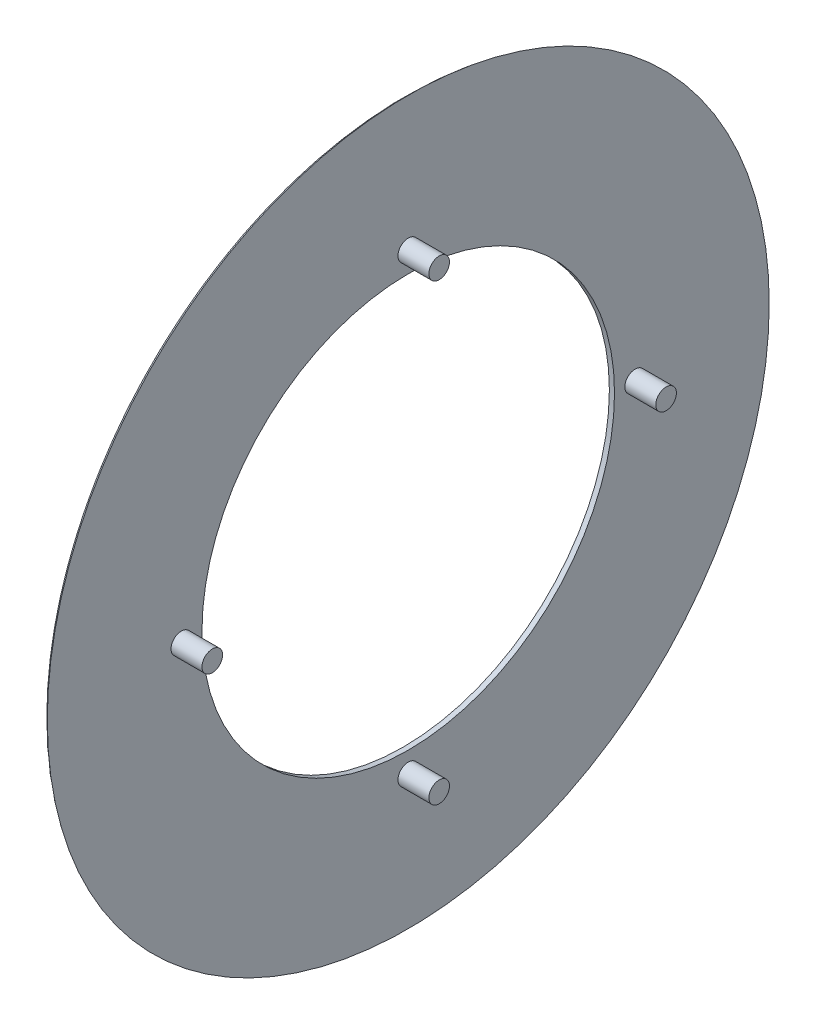
from build123d import *

# Parameters (mm, degrees)
SKETCH1_R           = 44.45
BOSS_EXTRUDE1_DEPTH = 0.635
SKETCH2_R           = 1.27
BOSS_EXTRUDE2_DEPTH = 3.81
CUT_EXTRUDE1_REACH  = 64.977
SKETCH3_R           = 25.4
FILLET1_R           = 1.27


with BuildPart() as part:
    # Sketch1 → Boss-Extrude1 (new body)
    with BuildSketch(Plane(origin=(0, 0, 0), x_dir=(0, 0, -1), z_dir=(1, 0, 0))):
        Circle(SKETCH1_R)
    extrude(amount=BOSS_EXTRUDE1_DEPTH)

    # Sketch2 → Boss-Extrude2 (add)
    with BuildSketch(Plane(origin=(0.635, 0, 0), x_dir=(0, 0, -1), z_dir=(1, 0, 0))):
        with Locations(Location((0, 27.94, 0), (0, 0, 180))):
            Circle(SKETCH2_R)
        with Locations(Location((27.94, 0, 0), (0, 0, 180))):
            Circle(SKETCH2_R)
        with Locations(Location((0, -27.94, 0), (0, 0, 180))):
            Circle(SKETCH2_R)
        with Locations(Location((-27.94, 0, 0), (0, 0, 180))):
            Circle(SKETCH2_R)
    extrude(amount=BOSS_EXTRUDE2_DEPTH)

    # Sketch3 → Cut-Extrude1 (cut, up to next)
    with BuildSketch(Plane(origin=(0.635, 0, 0), x_dir=(0, 0, -1), z_dir=(1, 0, 0)), mode=Mode.PRIVATE) as cut_extrude1_sk1:
        Circle(SKETCH3_R)
    cut_extrude1_tool1 = extrude(cut_extrude1_sk1.sketch, amount=-CUT_EXTRUDE1_REACH, mode=Mode.PRIVATE) & part.part
    add(cut_extrude1_tool1.solids().sort_by_distance((0.635, 0, 0))[0], mode=Mode.SUBTRACT)

    # Fillet1
    # the kernel refuses this fillet: 1.27 mm, written as the material it takes off along each edge
    with BuildSketch(Plane(origin=(0, 0, 0), x_dir=(0, 0, -1), z_dir=(0, -1, 0))) as fillet1_piece_1:
        with BuildLine():
            CenterArc((43.350147737, 1.27), FILLET1_R, 270, 60)
            Line((43.350147737, 0), (43.350147737, -0.0254))
            Line((43.350147737, -0.0254), (44.45, -0.0254))
            Line((44.45, -0.0254), (44.4754, 0))
            ThreePointArc((44.4754, 0), (44.4754, 0.3175), (44.471997045, 0.6223))
            Line((44.471997045, 0.6223), (44.45, 0.635))
        make_face()
    revolve(axis=Axis((0, 0, 0), (1, 0, 0)), mode=Mode.SUBTRACT)


solid = part.part
